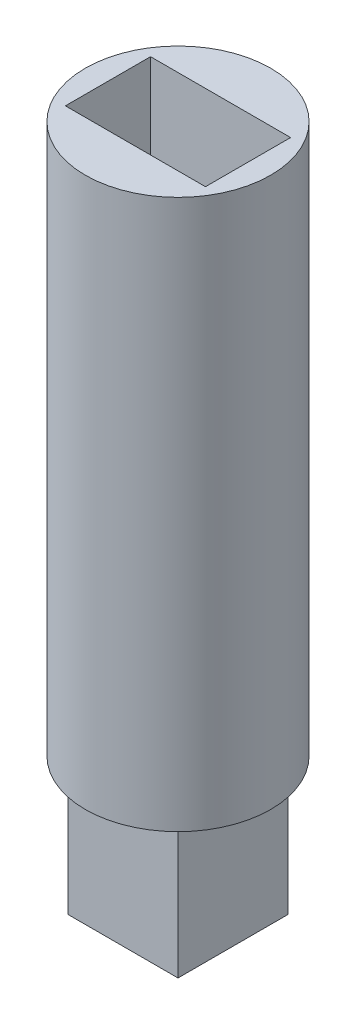
from build123d import *

# Parameters (mm, degrees)
SKETCH1_R           = 3.375
BOSS_EXTRUDE1_DEPTH = 20
SKETCH3_W           = 5.1
SKETCH3_H           = 3.1
CUT_EXTRUDE2_DEPTH  = 6
SKETCH2_W           = 4
SKETCH2_H           = 4
BOSS_EXTRUDE2_DEPTH = 5


with BuildPart() as part:
    # Sketch1 → Boss-Extrude1 (new body)
    with BuildSketch(Plane(origin=(0, 0, 0), x_dir=(1, 0, 0), z_dir=(0, 1, 0))):
        Circle(SKETCH1_R)
    extrude(amount=BOSS_EXTRUDE1_DEPTH)

    # Sketch3 → Cut-Extrude2 (cut)
    with BuildSketch(Plane(origin=(0, 20, 0), x_dir=(1, 0, 0), z_dir=(0, 1, 0))):
        Rectangle(SKETCH3_W, SKETCH3_H)
    extrude(amount=-CUT_EXTRUDE2_DEPTH, mode=Mode.SUBTRACT)

    # Sketch2 → Boss-Extrude2 (add)
    with BuildSketch(Plane(origin=(0, 0, 0), x_dir=(-1, 0, 0), z_dir=(0, -1, 0))):
        Rectangle(SKETCH2_W, SKETCH2_H)
    extrude(amount=BOSS_EXTRUDE2_DEPTH)


solid = part.part
